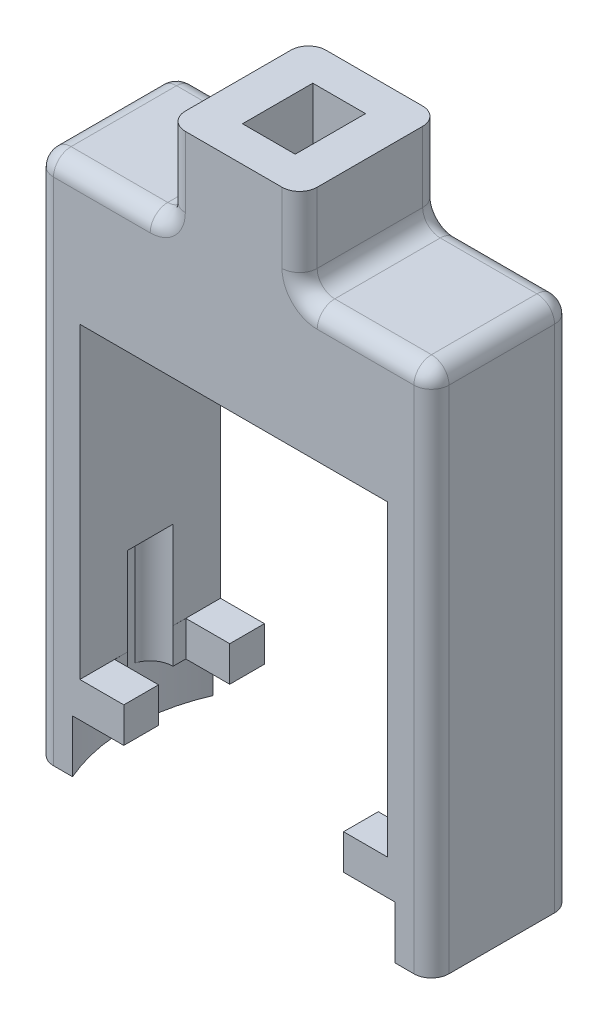
from build123d import *

# Parameters (mm, degrees)
EXTRUDE_1_DEPTH     = 4
EXTRUDE_2_DEPTH     = 12
CUT_EXTRUDE_1_DEPTH = 6
CUT_EXTRUDE_START   = -20
CUT_EXTRUDE_2_DEPTH = 14
SKETCH_1_5_R        = 2.5
EXTRUDE_3_DEPTH     = 5
SKETCH_7_W          = 6
SKETCH_7_H          = 8
CUT_EXTRUDE_3_DEPTH = 25
FILLET_2_R          = 2


# Read off the part's stored shape, not the designer's step: 切除-拉伸2, 镜向1
with BuildPart() as part:
    # 草图1 → 凸台-拉伸1 (new body)
    with BuildSketch(Plane.XY):
        Polygon((-6.44865866, 2.619047619), (-6.44865866, 27.619047619), (-13.94865866, 27.619047619), (-13.94865866, 17.619047619), (-28.94865866, 17.619047619), (-28.94865866, -42.380952381), (-18.94865866, -42.380952381), (-18.94865866, -32.380952381), (-23.94865866, -32.380952381), (-23.94865866, 2.619047619), align=None)
    extrude(amount=EXTRUDE_1_DEPTH)

    # 草图1<4> → 凸台-拉伸2 (add)
    with BuildSketch(Plane.XY):
        Polygon((-13.94865866, 2.619047619), (-6.44865866, 2.619047619), (-6.44865866, 27.619047619), (-13.94865866, 27.619047619), (-13.94865866, 17.619047619), (-28.94865866, 17.619047619), (-28.94865866, -42.380952381), (-18.94865866, -42.380952381), (-18.94865866, -32.380952381), (-23.94865866, -32.380952381), (-23.94865866, 2.619047619), (-23.94865866, 12.619047619), (-13.94865866, 12.619047619), align=None)
    extrude(amount=-EXTRUDE_2_DEPTH)

    # 草图5 → 切除-拉伸1 (cut)
    with BuildSketch(Plane.XZ.offset(42.380952381)):
        with BuildLine():
            Line((-18.94865866, 4), (-23.425219682, 4))
            Line((-23.425219682, 4), (-24.77896144, 4))
            ThreePointArc((-24.77896144, 4), (-26.44865866, -4), (-24.77896144, -12))
            Line((-24.77896144, -12), (-18.94865866, -12))
            Line((-18.94865866, -12), (-18.94865866, 4))
        make_face()
    extrude(amount=-CUT_EXTRUDE_1_DEPTH, mode=Mode.SUBTRACT)

    # 切除-拉伸2 outline → 切除-拉伸2 (cut)
    with BuildSketch(Plane.XZ.offset(42.380952381).offset(CUT_EXTRUDE_START)):
        with BuildLine():
            ThreePointArc((-23.94865866, -1.4), (-25.493875387, -1.908994198), (-26.434087232, -3.236688257))
            ThreePointArc((-26.434087232, -3.236688257), (-26.44865866, -4), (-26.434087231, -4.763311743))
            ThreePointArc((-26.434087231, -4.763311743), (-25.493875387, -6.091005802), (-23.94865866, -6.6))
            Line((-23.94865866, -6.6), (-23.938488984, -8.05))
            Line((-23.938488984, -8.05), (-18.94865866, -8.05))
            Line((-18.94865866, -8.05), (-18.94865866, 0.05))
            Line((-18.94865866, 0.05), (-23.938488984, 0.05))
            Line((-23.938488984, 0.05), (-23.94865866, -1.4))
        make_face()
    extrude(amount=CUT_EXTRUDE_2_DEPTH, mode=Mode.SUBTRACT)

    # 草图1<5> → 凸台-拉伸3 (add)
    with BuildSketch(Plane.XY):
        with Locations((-18.94865866, 7.619047619)):
            Circle(SKETCH_1_5_R)
    extrude(amount=-EXTRUDE_3_DEPTH)

    # 镜向1: part across plane


with BuildPart() as part_1:
    add(part.part)
    add(part.part.mirror(Plane(origin=(-6.44865866, 0, 4), x_dir=(0, 0, 1), z_dir=(1, 0, 0))))

    # 草图7 → 切除-拉伸3 (cut)
    with BuildSketch(Plane(origin=(0, 27.619047619, 0), x_dir=(1, 0, 0), z_dir=(0, 1, 0))):
        with Locations((-6.44865866, 4)):
            Rectangle(SKETCH_7_W, SKETCH_7_H)
    extrude(amount=-CUT_EXTRUDE_3_DEPTH, mode=Mode.SUBTRACT)

    # 圆角2
    fillet_2_edges = [part_1.edges().sort_by_distance(p)[0] for p in [
        (16.05134134, -12.380952381, 4),
        (8.55134134, 17.619047619, 4),
        (16.05134134, 17.619047619, -4),
        (1.05134134, 22.619047619, 4),
        (1.05134134, 17.619047619, -4),
        (1.05134134, 22.619047619, -12),
        (8.55134134, 17.619047619, -12),
        (16.05134134, -12.380952381, -12),
        (-28.94865866, 17.619047619, -4),
        (-13.94865866, 17.619047619, -4),
        (-13.94865866, 22.619047619, 4),
        (-21.44865866, 17.619047619, 4),
        (-28.94865866, -12.380952381, 4),
        (-13.94865866, 22.619047619, -12),
        (-28.94865866, -12.380952381, -12),
        (-21.44865866, 17.619047619, -12),
    ]]
    fillet(fillet_2_edges, radius=FILLET_2_R)


solid = part_1.part
